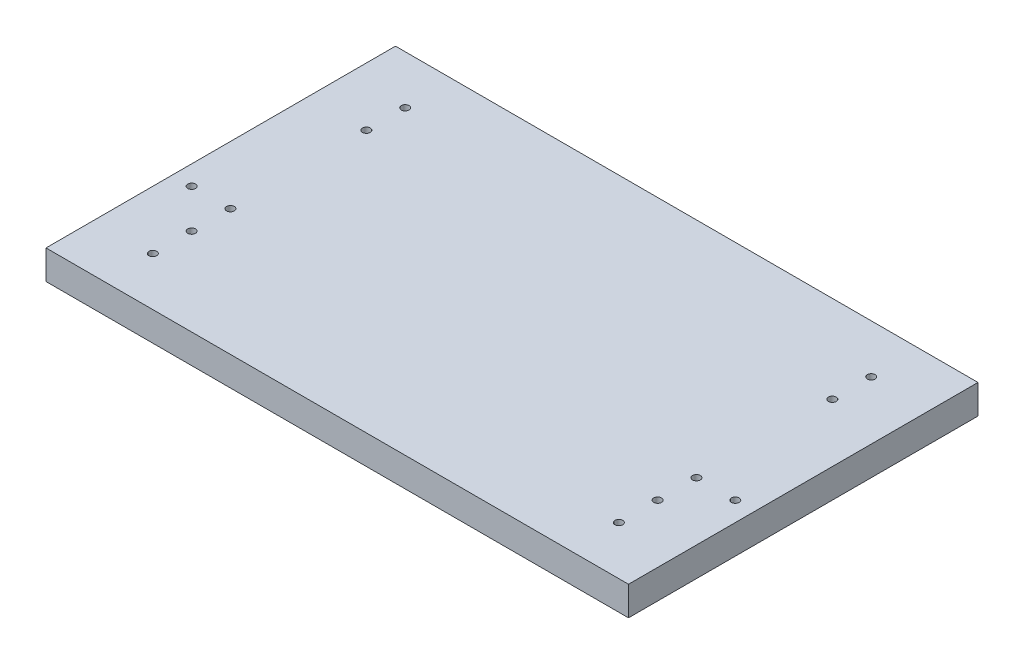
from build123d import *

# Parameters (mm, degrees)
CROQUIS1_W              = 300
CROQUIS1_H              = 180
SALIENTE_EXTRUIR1_DEPTH = 15
CROQUIS2_R              = 2
CORTAR_EXTRUIR1_DEPTH   = 10
CROQUIS3_R              = 2
CORTAR_EXTRUIR2_DEPTH   = 10


with BuildPart() as part:
    # Croquis1 → Saliente-Extruir1 (new body)
    with BuildSketch(Plane(origin=(0, 0, 0), x_dir=(1, 0, 0), z_dir=(0, 1, 0))):
        Rectangle(CROQUIS1_W, CROQUIS1_H)
    extrude(amount=SALIENTE_EXTRUIR1_DEPTH)

    # Croquis2 → Cortar-Extruir1 (cut)
    with BuildSketch(Plane(origin=(0, 15, 0), x_dir=(1, 0, 0), z_dir=(0, 1, 0))):
        with Locations((-120, -65)):
            Circle(CROQUIS2_R)
        with Locations((-120, -45)):
            Circle(CROQUIS2_R)
        with Locations((120, -65)):
            Circle(CROQUIS2_R)
        with Locations((120, -45)):
            Circle(CROQUIS2_R)
        with Locations((-140, -25)):
            Circle(CROQUIS2_R)
        with Locations((-120, -25)):
            Circle(CROQUIS2_R)
        with Locations((120, -25)):
            Circle(CROQUIS2_R)
        with Locations((140, -25)):
            Circle(CROQUIS2_R)
        with Locations((-120, 65)):
            Circle(CROQUIS2_R)
        with Locations((-120, 45)):
            Circle(CROQUIS2_R)
        with Locations((120, 45)):
            Circle(CROQUIS2_R)
        with Locations((120, 65)):
            Circle(CROQUIS2_R)
    extrude(amount=-CORTAR_EXTRUIR1_DEPTH, mode=Mode.SUBTRACT)

    # Croquis3 → Cortar-Extruir2 (cut)
    with BuildSketch(Plane.XZ):
        with Locations((-140, -65)):
            Circle(CROQUIS3_R)
    extrude(amount=-CORTAR_EXTRUIR2_DEPTH, mode=Mode.SUBTRACT)


solid = part.part
